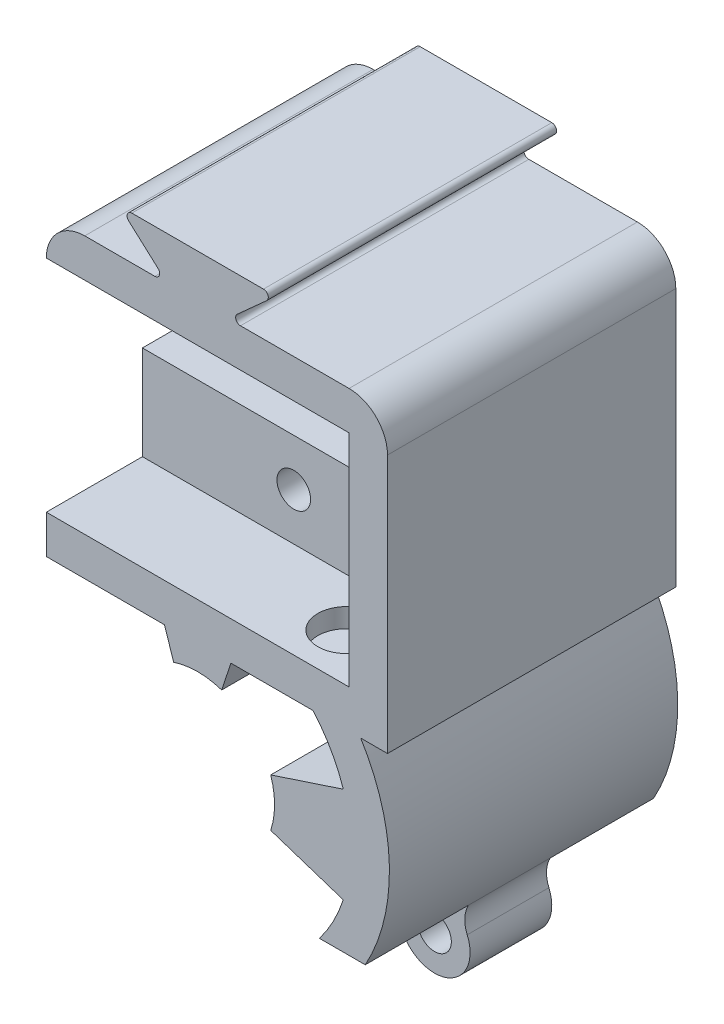
from build123d import *

# Parameters (mm, degrees)
EXTRUDE_1_DEPTH     = 15
EXTRUDE_START       = -4.25
EXTRUDE_2_OUTLINE_R = 1.75
EXTRUDE_2_DEPTH     = 8.5
EXTRUDE_START_2     = -15
SKETCH_1_4_W        = 4
SKETCH_1_4_H        = 13.1
SKETCH_1_4_R        = 1.05
EXTRUDE_3_DEPTH     = 13.3
SKETCH_1_6_R        = 1.75
EXTRUDE_5_DEPTH     = 20
EXTRUDE_START_3     = 15
EXTRUDE_6_DEPTH     = 7.5
EXTRUDE_7_DEPTH     = 7.5
SKETCH_2_R          = 3
CUT_EXTRUDE_1_DEPTH = 2


# Read off the part's stored shape, not the designer's step: Бобышка-Вытянуть2
with BuildPart() as part:
    # Эскиз1 → Бобышка-Вытянуть1 (new, symmetric)
    with BuildSketch(Plane.XY):
        with BuildLine():
            Line((-15.75, 4), (-15.75, 0))
            Line((-15.75, 0), (12.006352485, 0))
            ThreePointArc((12.006352485, 0), (15.941509182, -9.979629936), (12.665555468, -20.19464825))
            Line((12.665555468, -20.19464825), (17.436063068, -20.19464825))
            ThreePointArc((17.436063068, -20.19464825), (19.944534806, -10.033061691), (16.963269142, 0))
            Line((16.963269142, 0), (19.75, 0))
            Line((19.75, 0), (19.75, 26.9))
            ThreePointArc((19.75, 26.9), (18.578427125, 29.728427125), (15.75, 30.9))
            Line((15.75, 30.9), (4.452979114, 30.9))
            ThreePointArc((4.452979114, 30.9), (3.986168908, 31.220868116), (4.118496748, 31.771647073))
            Line((4.118496748, 31.771647073), (7.181503252, 34.528352927))
            ThreePointArc((7.181503252, 34.528352927), (7.313831092, 35.079131884), (6.847020886, 35.4))
            Line((6.847020886, 35.4), (-6.847020886, 35.4))
            ThreePointArc((-6.847020886, 35.4), (-7.313831092, 35.079131884), (-7.181503252, 34.528352927))
            Line((-7.181503252, 34.528352927), (-4.118496748, 31.771647073))
            ThreePointArc((-4.118496748, 31.771647073), (-3.986168908, 31.220868116), (-4.452979114, 30.9))
            Line((-4.452979114, 30.9), (-11.75, 30.9))
            ThreePointArc((-11.75, 30.9), (-14.578427125, 29.728427125), (-15.75, 26.9))
            Line((-15.75, 26.9), (15.75, 26.9))
            Line((15.75, 26.9), (15.75, 4))
            Line((15.75, 4), (-15.75, 4))
        make_face()
    extrude(amount=EXTRUDE_1_DEPTH, both=True)

    # Эскиз1<4> → Бобышка-Вытянуть3 (add)
    # profile 1 of 2: a face of its own
    with BuildSketch(Plane.XY.offset(EXTRUDE_START_2)):
        with Locations((-13.75, 20.35)):
            Rectangle(SKETCH_1_4_W, SKETCH_1_4_H)
        with Locations((-13.75, 20.35)):
            Circle(SKETCH_1_4_R, mode=Mode.SUBTRACT)
    # profile 2 of 2: a face of its own
    with BuildSketch(Plane.XY.offset(EXTRUDE_START_2)):
        with Locations((13.75, 20.35)):
            Rectangle(SKETCH_1_4_W, SKETCH_1_4_H)
        with Locations((13.75, 20.35)):
            Circle(SKETCH_1_4_R, mode=Mode.SUBTRACT)
    extrude(amount=EXTRUDE_3_DEPTH)

    # Эскиз1<6> → Бобышка-Вытянуть5 (add)
    with BuildSketch(Plane.XY.offset(EXTRUDE_START_2)):
        Polygon((-11.75, 13.8), (11.75, 13.8), (15.75, 13.8), (15.75, 4), (-15.75, 4), (-15.75, 13.8), align=None)
        with Locations((0, 8.9)):
            Circle(SKETCH_1_6_R, mode=Mode.SUBTRACT)
    extrude(amount=EXTRUDE_5_DEPTH)

    # Эскиз1<7> → Бобышка-Вытянуть6 (add)
    with BuildSketch(Plane.XY.offset(EXTRUDE_START_3)):
        with BuildLine():
            Line((3.454246399, 0), (-3.454246399, 0))
            Line((-3.454246399, 0), (-2.5, -2.900657923))
            ThreePointArc((-2.5, -2.900657923), (0, -2.5), (2.5, -2.900657923))
            Line((2.5, -2.900657923), (3.454246399, 0))
        make_face()
        with BuildLine():
            ThreePointArc((15.151188266, -15.484375), (15.95, -10.5), (15.151188266, -5.515625))
            Line((15.151188266, -5.515625), (7.599342077, -8))
            ThreePointArc((7.599342077, -8), (8, -10.5), (7.599342077, -13))
            Line((7.599342077, -13), (15.151188266, -15.484375))
        make_face()
    extrude(amount=-EXTRUDE_6_DEPTH)

    # Эскиз1<8> → Бобышка-Вытянуть7 (add)
    with BuildSketch(Plane.XY.offset(EXTRUDE_START_2)):
        with BuildLine():
            Line((3.454246399, 0), (-3.454246399, 0))
            Line((-3.454246399, 0), (-2.5, -2.900657923))
            ThreePointArc((-2.5, -2.900657923), (0, -2.5), (2.5, -2.900657923))
            Line((2.5, -2.900657923), (3.454246399, 0))
        make_face()
        with BuildLine():
            ThreePointArc((15.151188266, -15.484375), (15.95, -10.5), (15.151188266, -5.515625))
            Line((15.151188266, -5.515625), (7.599342077, -8))
            ThreePointArc((7.599342077, -8), (8, -10.5), (7.599342077, -13))
            Line((7.599342077, -13), (15.151188266, -15.484375))
        make_face()
    extrude(amount=EXTRUDE_7_DEPTH)

    # Эскиз2 → Вырез-Вытянуть1 (cut)
    with BuildSketch(Plane(origin=(0, 4, 0), x_dir=(1, 0, 0), z_dir=(0, 1, 0))):
        with Locations(Location((10.5, -10, 0), (0, 0, 180))):
            Circle(SKETCH_2_R)
    extrude(amount=-CUT_EXTRUDE_1_DEPTH, mode=Mode.SUBTRACT)


with BuildPart() as body_2:
    # Бобышка-Вытянуть2 outline → Бобышка-Вытянуть2 (new body)
    with BuildSketch(Plane.XY.offset(EXTRUDE_START)):
        with BuildLine():
            ThreePointArc((11.27835316, -21.77835316), (13.195055264, -28.02790707), (17.295400741, -22.936950579))
            ThreePointArc((17.295400741, -22.936950579), (17.047434126, -21.549472802), (17.436063068, -20.19464825))
            ThreePointArc((17.436063068, -20.19464825), (19.944534806, -10.033061691), (16.963269142, 0))
            Line((16.963269142, 0), (12.006352485, 0))
            ThreePointArc((12.006352485, 0), (15.94109613, -11.032873498), (11.27835316, -21.77835316))
        make_face()
        with Locations((13.89464825, -24.39464825)):
            Circle(EXTRUDE_2_OUTLINE_R, mode=Mode.SUBTRACT)
    extrude(amount=EXTRUDE_2_DEPTH)


solid = Compound([part.part, body_2.part])
